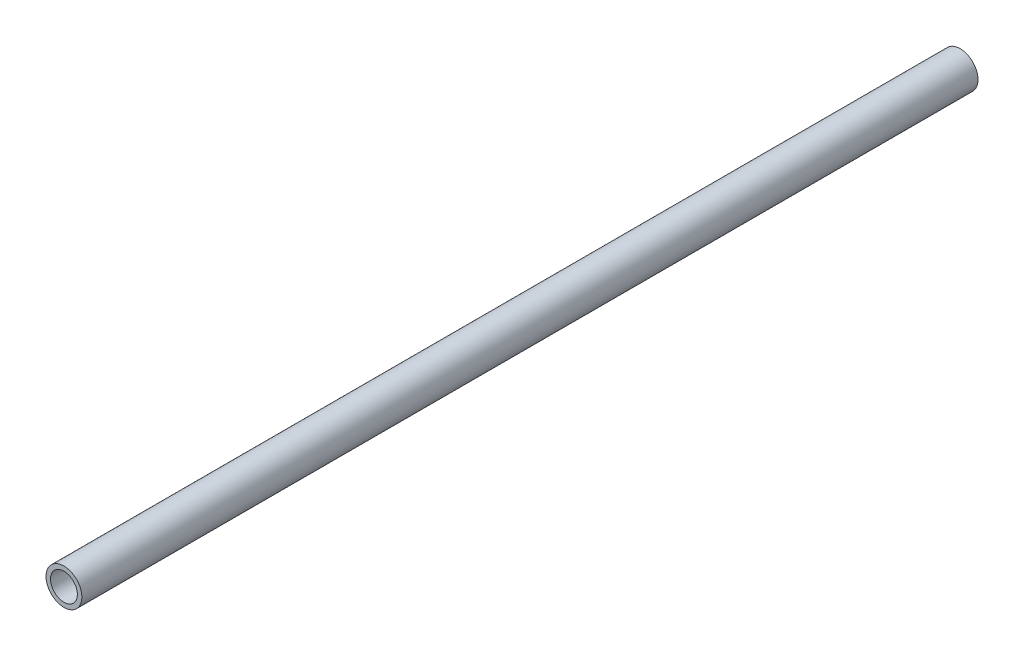
from build123d import *

# Parameters (mm, degrees)
SKETCH1_R           = 12.7
SKETCH1_R_2         = 9.525
BOSS_EXTRUDE1_DEPTH = 635


with BuildPart() as part:
    # Sketch1 → Boss-Extrude1 (new body)
    with BuildSketch(Plane.XY):
        Circle(SKETCH1_R)
        Circle(SKETCH1_R_2, mode=Mode.SUBTRACT)
    extrude(amount=BOSS_EXTRUDE1_DEPTH)


solid = part.part
